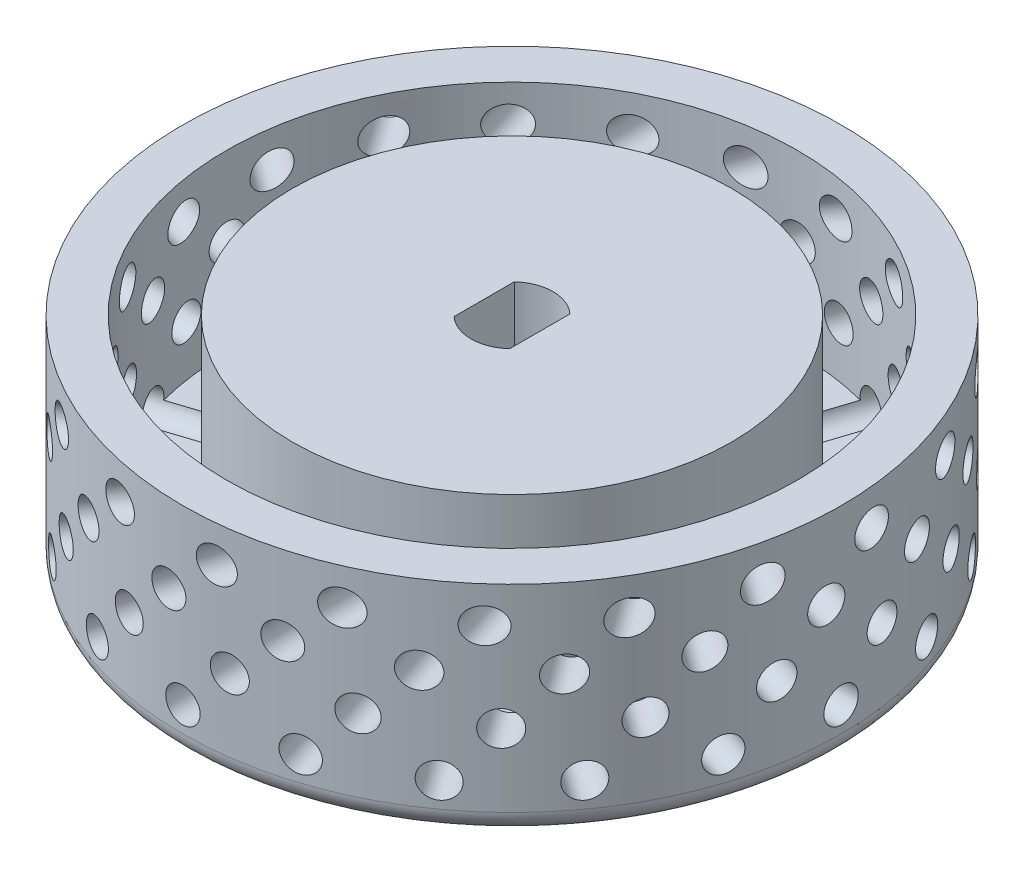
from build123d import *

# Parameters (mm, degrees)
CROQUIS1_R              = 22.5
SALIENTE_EXTRUIR1_DEPTH = 15
VACIADO1_T              = -3
REDONDEO1_R             = 1.5
CROQUIS2_R              = 8.1
SALIENTE_EXTRUIR2_DEPTH = 4
REDONDEO2_R             = 1.5
CROQUIS5_R              = 15
SALIENTE_EXTRUIR3_DEPTH = 12
CORTAR_EXTRUIR3_DEPTH   = 7
CROQUIS12_R             = 2.975585662
CORTAR_EXTRUIR4_DEPTH   = 5
CROQUIS13_R             = 1.175
CORTAR_EXTRUIR5_DEPTH   = 7
MATRIZC1_COUNT          = 20


with BuildPart() as part:
    # Croquis1 → Saliente-Extruir1 (new body)
    with BuildSketch(Plane(origin=(0, 0, 0), x_dir=(1, 0, 0), z_dir=(0, 1, 0))):
        with Locations(Location((0, 0, 0), (0, 0, 270))):
            Circle(CROQUIS1_R)
    extrude(amount=SALIENTE_EXTRUIR1_DEPTH)

    # Vaciado1
    vaciado1_openings = [part.faces().sort_by_distance(p)[0] for p in [
        (0, 15, 0),
    ]]
    offset(amount=VACIADO1_T, openings=vaciado1_openings, kind=Kind.INTERSECTION)

    # Redondeo1
    redondeo1_edges = [part.edges().sort_by_distance(p)[0] for p in [
        (0, 0, -22.5),
    ]]
    fillet(redondeo1_edges, radius=REDONDEO1_R)

    # Croquis2 → Saliente-Extruir2 (add)
    with BuildSketch(Plane.XZ):
        with Locations(Location((0, 0, 0), (0, 0, 90))):
            Circle(CROQUIS2_R)
    extrude(amount=SALIENTE_EXTRUIR2_DEPTH)

    # Redondeo2
    redondeo2_edges = [part.edges().sort_by_distance(p)[0] for p in [
        (0, -4, -8.1),
    ]]
    fillet(redondeo2_edges, radius=REDONDEO2_R)

    # Croquis5 → Saliente-Extruir3 (add)
    with BuildSketch(Plane(origin=(0, 3, 0), x_dir=(1, 0, 0), z_dir=(0, 1, 0))):
        with Locations(Location((0, 0, 0), (0, 0, 270))):
            Circle(CROQUIS5_R)
    extrude(amount=SALIENTE_EXTRUIR3_DEPTH)

    # Croquis6 → Cortar-Extruir3 (cut)
    with BuildSketch(Plane(origin=(0, 15, 0), x_dir=(1, 0, 0), z_dir=(0, 1, 0))):
        with BuildLine():
            ThreePointArc((1.9, 2.05669638), (0, 2.8), (-1.9, 2.05669638))
            Line((-1.9, 2.05669638), (-1.9, -2.05669638))
            ThreePointArc((-1.9, -2.05669638), (0, -2.8), (1.9, -2.05669638))
            Line((1.9, -2.05669638), (1.9, 2.05669638))
        make_face()
    extrude(amount=-CORTAR_EXTRUIR3_DEPTH, mode=Mode.SUBTRACT)

    # Croquis10 → Refrentado para tornillo con cabeza troncocónica de M2.51 (revolve, cut)
    with BuildSketch(Plane(origin=(0, -4, 0), x_dir=(0, 0, -1), z_dir=(1, 0, 0))):
        Polygon((0, 0), (0, 19), (1.45, 19), (1.45, 2.1), (3, 2.1), (3, 0), align=None)
    revolve(axis=Axis((0, -10.35, 0), (0, 1, 0)), mode=Mode.SUBTRACT)

    # Croquis12 → Cortar-Extruir4 (cut)
    with BuildSketch(Plane.XZ.offset(1.9)):
        with Locations(Location((0, 0, 0), (0, 0, 270))):
            Circle(CROQUIS12_R)
    extrude(amount=-CORTAR_EXTRUIR4_DEPTH, mode=Mode.SUBTRACT)

    # Croquis13 → Cortar-Extruir5 (cut)
    with BuildSketch(Plane(origin=(0, 0, -22.5), x_dir=(-1, 0, 0), z_dir=(0, 0, -1))):
        with Locations((6, 9.595667796)):
            Circle(CROQUIS13_R)
        with Locations((3, 6.46940432)):
            Circle(CROQUIS13_R)
        with Locations(Location((0, 3.210108355, 0), (0, 0, 349.69921931))):
            Circle(CROQUIS13_R)
        with Locations((9, 12.52238254)):
            Circle(CROQUIS13_R)
    cortar_extruir5 = extrude(amount=-CORTAR_EXTRUIR5_DEPTH, mode=Mode.SUBTRACT)

    # MatrizC1: Cortar-Extruir5 ×20 about axis
    matrizc1_axis = Axis((0, 0, 0), (0, 1, 0))
    for i in range(1, MATRIZC1_COUNT):
        add(cortar_extruir5.rotate(matrizc1_axis, i * 360 / MATRIZC1_COUNT), mode=Mode.SUBTRACT)


solid = part.part
